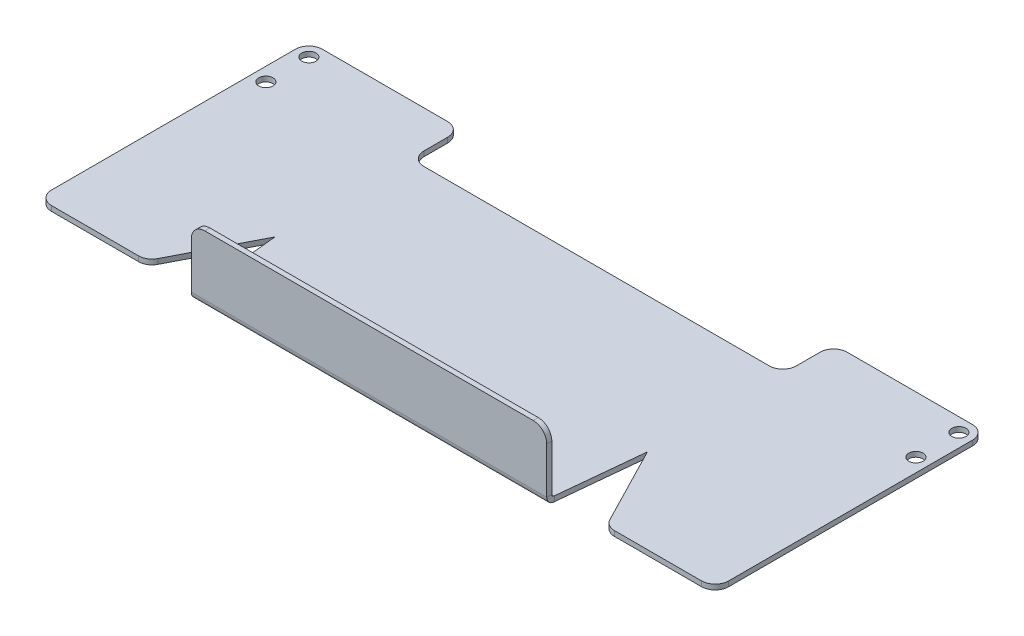
from build123d import *

# Parameters (mm, degrees)
SKETCH_18_W            = 200
SKETCH_18_H            = 100
SM_BASE_FLANGE_3_DEPTH = 1.5
SKETCH_23_W            = 55
SKETCH_23_H            = 15
SKETCH_23_W_2          = 47.5
SKETCH_23_H_2          = 20
CUT_EXTRUDE_1_DEPTH    = 1.5
CUT_EXTRUDE_2_DEPTH    = 1.5
OTHER_START            = -52.5
OTHER_2_DEPTH          = 105
OTHER_2_2_DEPTH        = 105
FILLET_1_R             = 4
SKETCH_26_R            = 2.1
CUT_EXTRUDE_3_DEPTH    = 1.5


# Read off the part's stored shape, not the designer's step: 绘制的折弯2
# Sheet-metal steps are written as plain solids
with BuildPart() as part:
    # 草图18 → 基体-法兰3 (new body)
    with BuildSketch(Plane(origin=(0, 0, 0), x_dir=(1, 0, 0), z_dir=(0, 1, 0))):
        Rectangle(SKETCH_18_W, SKETCH_18_H)
    extrude(amount=-SM_BASE_FLANGE_3_DEPTH)

    # 草图23 → 切除-拉伸1 (cut)
    with BuildSketch(Plane(origin=(0, 0, 0), x_dir=(1, 0, 0), z_dir=(0, 1, 0))):
        with Locations((27.5, 42.5)):
            Rectangle(SKETCH_23_W, SKETCH_23_H)
        with Locations((-27.5, 42.5)):
            Rectangle(SKETCH_23_W, SKETCH_23_H)
        with Locations((76.25, -40)):
            Rectangle(SKETCH_23_W_2, SKETCH_23_H_2)
        with Locations((-76.25, -40)):
            Rectangle(SKETCH_23_W_2, SKETCH_23_H_2)
    extrude(amount=-CUT_EXTRUDE_1_DEPTH, mode=Mode.SUBTRACT)

    # 草图24 → 切除-拉伸2 (cut)
    with BuildSketch(Plane(origin=(0, 0, 0), x_dir=(1, 0, 0), z_dir=(0, 1, 0))):
        Polygon((-52.5, -30), (-55, -5), (-67.872428489, -30), align=None)
        Polygon((55, -5), (67.872428489, -30), (52.5, -30), align=None)
    extrude(amount=-CUT_EXTRUDE_2_DEPTH, mode=Mode.SUBTRACT)

    # Other 2 outline → Other 2 (cut)
    with BuildSketch(Plane.YZ.offset(OTHER_START)):
        with BuildLine():
            ThreePointArc((-1.5, 30), (-1.086838938, 31.295164082), (0, 32.111823856))
            Line((0, 32.111823856), (0, 50))
            Line((0, 50), (-1.5, 50))
            Line((-1.5, 50), (-1.5, 30))
        make_face()
    extrude(amount=OTHER_2_DEPTH, mode=Mode.SUBTRACT)

    # Other 2 2 outline → Other 2 2 (add)
    with BuildSketch(Plane.YZ.offset(OTHER_START)):
        with BuildLine():
            Line((18.401454181, 30.7366), (18.401454181, 32.2366))
            Line((18.401454181, 32.2366), (0.7366, 32.2366))
            ThreePointArc((0.7366, 32.2366), (0.363053267, 32.205185343), (0, 32.111823856))
            Line((0, 32.111823856), (0, 30))
            ThreePointArc((0, 30), (0.215745145, 30.520854855), (0.7366, 30.7366))
            Line((0.7366, 30.7366), (18.401454181, 30.7366))
        make_face()
    extrude(amount=OTHER_2_2_DEPTH)

    # 圆角1
    fillet_1_edges = [part.edges().sort_by_distance(p)[0] for p in [
        (67.872428489, -0.75, 30),
        (100, -0.75, 30),
        (100, -0.75, -50),
        (55, -0.75, -50),
        (55, -0.75, -35),
        (-55, -0.75, -35),
        (-55, -0.75, -50),
        (-100, -0.75, -50),
        (-100, -0.75, 30),
        (-67.872428489, -0.75, 30),
        (52.5, 18.401454181, 31.4866),
        (-52.5, 18.401454181, 31.4866),
    ]]
    fillet(fillet_1_edges, radius=FILLET_1_R)

    # 草图26 → 切除-拉伸3 (cut)
    with BuildSketch(Plane(origin=(0, 0, 0), x_dir=(1, 0, 0), z_dir=(0, 1, 0))):
        with Locations(Location((-96, 46, 0), (0, 0, 270))):
            Circle(SKETCH_26_R)
        with Locations(Location((-96, 33.3, 0), (0, 0, 270))):
            Circle(SKETCH_26_R)
        with Locations(Location((96, 33.3, 0), (0, 0, 90))):
            Circle(SKETCH_26_R)
        with Locations(Location((96, 46, 0), (0, 0, 90))):
            Circle(SKETCH_26_R)
    extrude(amount=-CUT_EXTRUDE_3_DEPTH, mode=Mode.SUBTRACT)


solid = part.part
